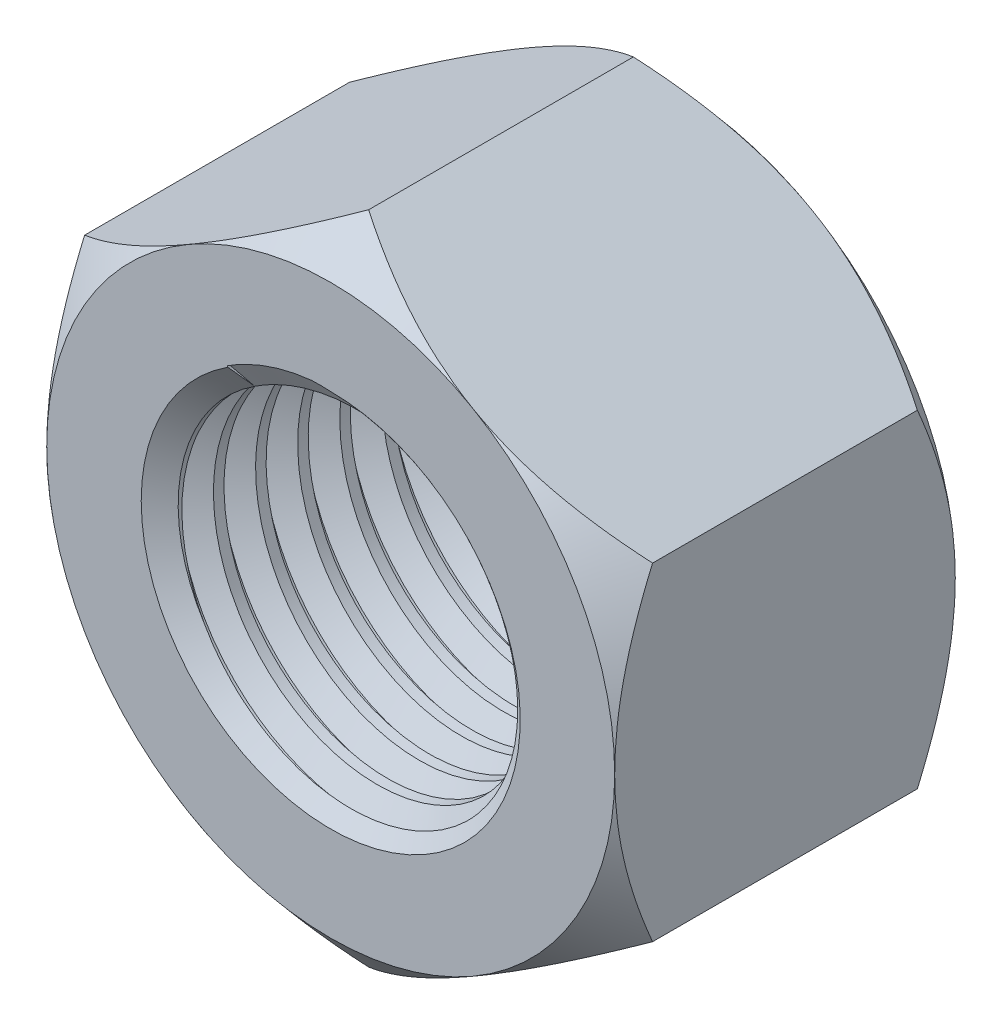
from build123d import *

# Parameters (mm, degrees)
BASENUTSKE_R  = 4.2164
BASENUT_DEPTH = 8.5598
THREAD1_PITCH = 1.058333333


with BuildPart() as part:
    # BaseNutSke → BaseNut (new body)
    with BuildSketch(Plane.XY):
        Polygon((7.1374, 4.120779811), (7.1374, -4.120779811), (0, -8.241559623), (-7.1374, -4.120779811), (-7.1374, 4.120779811), (0, 8.241559623), align=None)
        Circle(BASENUTSKE_R, mode=Mode.SUBTRACT)
    extrude(amount=-BASENUT_DEPTH)

    # Sketch3 → Double-Chamfer (revolve, cut)
    with BuildSketch(Plane(origin=(0, 0, 0), x_dir=(0, 0, -1), z_dir=(1, 0, 0))):
        Polygon((8.5598, 7.1374), (7.6073, 8.241559623), (7.6073, 20.941559623), (21.2598, 20.941559623), (21.2598, 7.1374), align=None)
        Polygon((0.9525, 20.941559623), (-12.7, 20.941559623), (-12.7, 7.1374), (0, 7.1374), (0.9525, 8.241559623), align=None)
    revolve(axis=Axis((0, 0, 0), (0, 0, -1)), mode=Mode.SUBTRACT)

    # Sketch5 → EndChamfer (revolve, cut)
    with BuildSketch(Plane(origin=(0, 0, 0), x_dir=(0, 0, -1), z_dir=(1, 0, 0)), mode=Mode.PRIVATE) as endchamfer_sk:
        Polygon((8.5344, 4.7625), (8.11377833, 4.16179), (8.5852, 4.16179), (8.5852, 4.7625), align=None)
        Polygon((-0.0508, 4.7625), (0, 4.7625), (0.42062167, 4.16179), (-0.0508, 4.16179), align=None)
    revolve(endchamfer_sk.sketch.rotate(Axis((0, 0, -25.037505729), (0, 0, -1)), 90), axis=Axis((0, 0, -25.037505729), (0, 0, -1)), mode=Mode.SUBTRACT)

    # Thread1: the profile of Thread Profile1 profile screwed along a right-hand helix of 7.341386 turns, 8 arcs to a turn; built about Z, then put on its axis
    thread1_z = Axis((0, 0, 0), (0, 0, 1))
    thread1_corners = [(4.2161, 0, -0.000173205), (4.789239718, 0, 0.330729165), (4.789239718, 0, 0.463020832), (4.2161, 0, 0.793923202)]
    with BuildLine(mode=Mode.PRIVATE) as thread1_profile:
        Line(thread1_corners[0], thread1_corners[1])
        Line(thread1_corners[1], thread1_corners[2])
        Line(thread1_corners[2], thread1_corners[3])
        Line(thread1_corners[3], thread1_corners[0])
    thread1_cap = Face(thread1_profile.wire())
    thread1_turn_angles = [0, 22.5, 45, 67.5, 90, 112.5, 135, 157.5, 180, 202.5, 225, 247.5, 270, 292.5, 315, 337.5, 360]
    thread1_turn_weights = [1, 0.9238795325112867, 1, 0.9238795325112867, 1, 0.9238795325112867, 1, 0.9238795325112867, 1, 0.9238795325112867, 1, 0.9238795325112867, 1, 0.9238795325112867, 1, 0.9238795325112867, 1]
    thread1_turn_rails = [Edge.make_bspline([Vector(p[0], p[1], 0).rotate(thread1_z, thread1_turn_angles[k]) / thread1_turn_weights[k] + Vector(0, 0, p[2] + THREAD1_PITCH * thread1_turn_angles[k] / 360) for k in range(17)], [0, 0, 0, 1, 1, 2, 2, 3, 3, 4, 4, 5, 5, 6, 6, 7, 7, 8, 8, 8], 2, thread1_turn_weights) for p in thread1_corners]
    thread1_turn_sides = [Face.make_surface_from_curves(thread1_turn_rails[p[0]], thread1_turn_rails[p[1]]) for p in [(0, 1), (1, 2), (2, 3), (3, 0)]]
    thread1_last_angles = [2520, 2542.5, 2565, 2587.5, 2610, 2626.449447702, 2642.898895404]
    thread1_last_weights = [1, 0.9238795325112867, 1, 0.9238795325112867, 1, 0.9590699495206321, 1]
    thread1_last_rails = [Edge.make_bspline([Vector(p[0], p[1], 0).rotate(thread1_z, thread1_last_angles[k]) / thread1_last_weights[k] + Vector(0, 0, p[2] + THREAD1_PITCH * thread1_last_angles[k] / 360) for k in range(7)], [0, 0, 0, 1, 1, 2, 2, 3, 3, 3], 2, thread1_last_weights) for p in thread1_corners]
    thread1_last_sides = [Face.make_surface_from_curves(thread1_last_rails[p[0]], thread1_last_rails[p[1]]) for p in [(0, 1), (1, 2), (2, 3), (3, 0)]]
    thread1 = Plane(origin=(0, 0, -8.152016663), x_dir=(1, 0, 0), z_dir=(0, 0, 1)) * Solid(Shell([*[p.moved(Location((0, 0, THREAD1_PITCH * i))) for i in range(7) for p in thread1_turn_sides], *thread1_last_sides, thread1_cap, thread1_cap.rotate(thread1_z, 2642.898895404).moved(Location((0, 0, THREAD1_PITCH * 2642.898895404 / 360)))]))
    add(thread1, mode=Mode.SUBTRACT)


solid = part.part
